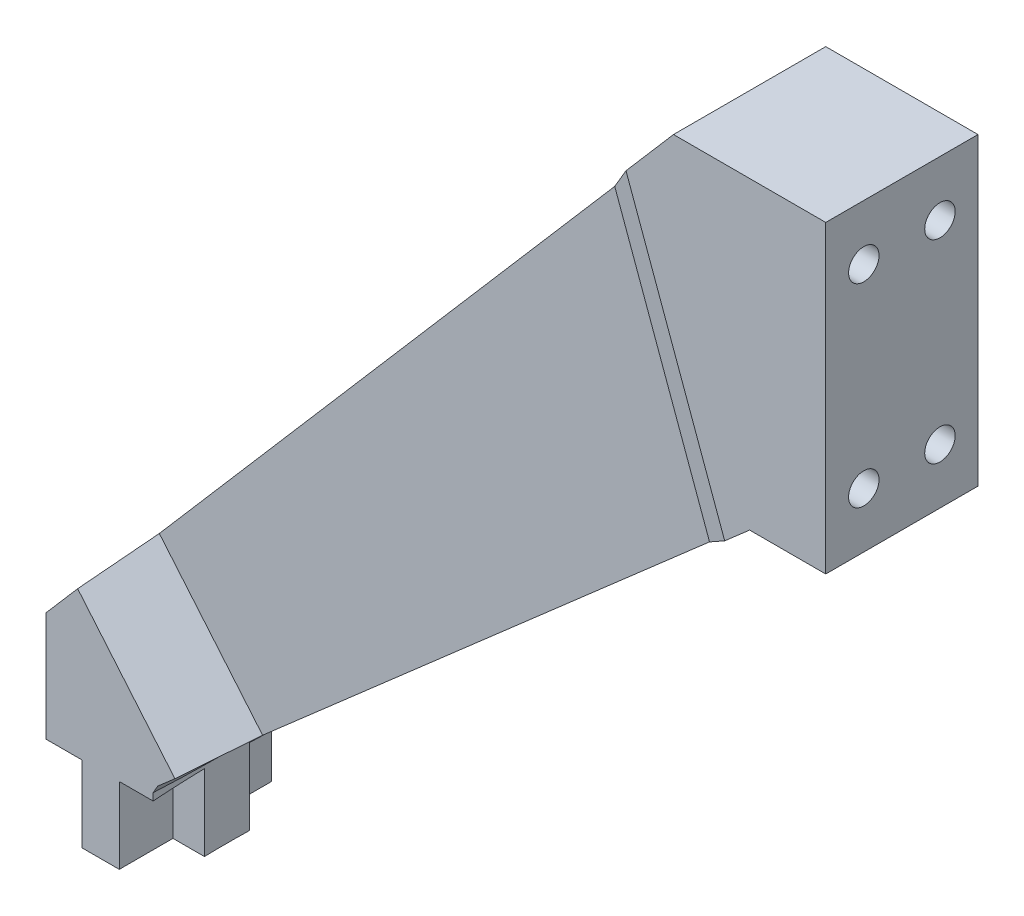
from build123d import *

# Parameters (mm, degrees)
BOSS_EXTRUDE1_DEPTH        = 10
SKETCH2_W                  = 5.05
SKETCH2_H                  = 7.05
CUT_EXTRUDE6_DEPTH         = 10
CUT_EXTRUDE7_DEPTH         = 5
CHAMFER2_SIZE              = 5.196152423
CHAMFER2_SIZE_2            = 9
CHAMFER2_OF_MIRROR4_SIZE   = 5.196152423
CHAMFER2_OF_MIRROR4_SIZE_2 = 9
SKETCH5_R                  = 2
CUT_EXTRUDE5_DEPTH         = 6
CUT_EXTRUDE8_START         = -120
CUT_EXTRUDE8_DEPTH         = 24.374622763
SKETCH8_R                  = 144.95
CUT_EXTRUDE9_DEPTH         = 12
BOSS_EXTRUDE2_DEPTH        = 20


# Read off the part's stored shape, not the designer's step: Cut-Extrude8
with BuildPart() as part:
    # Sketch1 → Boss-Extrude1 (new, symmetric)
    with BuildSketch(Plane.XY):
        Polygon((0, 120), (0, 80), (-10, 80), (-87.75, 12), (-87.75, 0), (-102.75, 0), (-102.75, 24), (-20, 120), align=None)
    extrude(amount=BOSS_EXTRUDE1_DEPTH, both=True)

    # Sketch2 → Cut-Extrude6 (cut)
    with BuildSketch(Plane.XZ):
        with Locations((-100.225, 6.475)):
            Rectangle(SKETCH2_W, SKETCH2_H)
        with Locations((-90.275, 6.475)):
            Rectangle(SKETCH2_W, SKETCH2_H)
        with Locations((-90.275, -6.475)):
            Rectangle(SKETCH2_W, SKETCH2_H)
        with Locations((-100.225, -6.475)):
            Rectangle(SKETCH2_W, SKETCH2_H)
    extrude(amount=-CUT_EXTRUDE6_DEPTH, mode=Mode.SUBTRACT)

    # Sketch6 → Cut-Extrude7 (cut)
    with BuildSketch(Plane.XY.offset(10)):
        Polygon((-98.494242528, 28.937192959), (-85.75, 13.749196141), (-13, 77.376205788), (-25.986145629, 113.055347669), align=None)
    cut_extrude7 = extrude(amount=-CUT_EXTRUDE7_DEPTH, mode=Mode.SUBTRACT)

    # Chamfer2
    # the kernel refuses this chamfer: 9, 5.196152423 mm, written as the material it adds along each edge
    with BuildSketch(Plane(origin=(-5.036481035, 55.496617251, 5), x_dir=(0.05440243528858507, 0.019800867116638043, 0.9983227437537925), z_dir=(-0.342020143325666, 0.9396926207859094, 0))) as chamfer2_piece_1_section:
        Polygon((CHAMFER2_SIZE * 0.998322743697, -CHAMFER2_SIZE * 0.0578938623994), (-CHAMFER2_SIZE_2 * 0.0578938624027, -CHAMFER2_SIZE_2 * 0.998322743754), (0, 0), align=None)
    chamfer2_piece_1 = extrude(amount=84.536493315, mode=Mode.PRIVATE)
    chamfer2_piece_1 = split(chamfer2_piece_1, bisect_by=Plane(origin=(-21.83844233, 92.842389445, 10), z_dir=(0, 0, -1)), keep=Keep.TOP, mode=Mode.PRIVATE)
    chamfer2_piece_1 = split(chamfer2_piece_1, bisect_by=Plane(origin=(-34.214088998, 103.509939047, 6.650101228), z_dir=(0.7574435982041207, -0.6529006015769894, 0)), keep=Keep.TOP, mode=Mode.PRIVATE)
    chamfer2_piece_1 = split(chamfer2_piece_1, bisect_by=Plane(origin=(-10.343648825, 79.699445401, 6.650101228), z_dir=(-0.6583332390976693, 0.7527266079388791, 0)), keep=Keep.TOP, mode=Mode.PRIVATE)
    add(chamfer2_piece_1)
    with BuildSketch(Plane(origin=(-113.460762542, 46.773596955, 5), x_dir=(-0.04434927158426045, -0.03721345742933334, 0.9983227437537927), z_dir=(0.642787609686533, -0.7660444431189835, 0))) as chamfer2_piece_2_section:
        Polygon((CHAMFER2_SIZE * 0.998322743697, -CHAMFER2_SIZE * 0.0578938623994), (-CHAMFER2_SIZE_2 * 0.0578938624027, -CHAMFER2_SIZE_2 * 0.998322743754), (0, 0), align=None)
    chamfer2_piece_2 = extrude(amount=66.394065339, mode=Mode.PRIVATE)
    chamfer2_piece_2 = split(chamfer2_piece_2, bisect_by=Plane(origin=(-97.520772346, 30.066536009, 6.631431033), z_dir=(0.7574435982041207, -0.6529006015769894, 0)), keep=Keep.TOP, mode=Mode.PRIVATE)
    chamfer2_piece_2 = split(chamfer2_piece_2, bisect_by=Plane(origin=(-83.277010041, 15.912068389, 6.631431033), z_dir=(-0.6583332390976693, 0.7527266079388791, 0)), keep=Keep.TOP, mode=Mode.PRIVATE)
    chamfer2_piece_2 = split(chamfer2_piece_2, bisect_by=Plane(origin=(-89.945880011, 23.537136627, 10), z_dir=(0, 0, -1)), keep=Keep.TOP, mode=Mode.PRIVATE)
    add(chamfer2_piece_2)

    # Mirror4: Cut-Extrude7 across plane
    add(cut_extrude7.mirror(Plane.XY), mode=Mode.SUBTRACT)

    # Chamfer2 of Mirror4
    # the kernel refuses this chamfer: 9, 5.196152423 mm, written as the material it adds along each edge
    with BuildSketch(Plane(origin=(-5.036481035, 55.496617251, -5), x_dir=(0.05440243528858507, 0.019800867116638043, -0.9983227437537925), z_dir=(-0.342020143325666, 0.9396926207859094, 0))) as chamfer2_of_mirror4_piece_1_section:
        Polygon((CHAMFER2_OF_MIRROR4_SIZE * 0.998322743697, CHAMFER2_OF_MIRROR4_SIZE * 0.0578938623994), (-CHAMFER2_OF_MIRROR4_SIZE_2 * 0.0578938624027, CHAMFER2_OF_MIRROR4_SIZE_2 * 0.998322743754), (0, 0), align=None)
    chamfer2_of_mirror4_piece_1 = extrude(amount=84.536493315, mode=Mode.PRIVATE)
    chamfer2_of_mirror4_piece_1 = split(chamfer2_of_mirror4_piece_1, bisect_by=Plane(origin=(-34.214088998, 103.509939047, -6.650101228), z_dir=(0.7574435982040639, -0.6529006015770552, 0)), keep=Keep.TOP, mode=Mode.PRIVATE)
    chamfer2_of_mirror4_piece_1 = split(chamfer2_of_mirror4_piece_1, bisect_by=Plane(origin=(-10.343648825, 79.699445401, -6.650101228), z_dir=(-0.6583332390977968, 0.7527266079387677, 0)), keep=Keep.TOP, mode=Mode.PRIVATE)
    chamfer2_of_mirror4_piece_1 = split(chamfer2_of_mirror4_piece_1, bisect_by=Plane(origin=(-21.83844233, 92.842389445, -10), z_dir=(0, 0, 1)), keep=Keep.TOP, mode=Mode.PRIVATE)
    add(chamfer2_of_mirror4_piece_1)
    with BuildSketch(Plane(origin=(-113.460762542, 46.773596955, -5), x_dir=(0.7659013618145366, 0.6426675502167433, 0.019326765612700778), z_dir=(0.642787609686533, -0.7660444431189835, 0))) as chamfer2_of_mirror4_piece_2_section:
        Polygon((CHAMFER2_OF_MIRROR4_SIZE_2 * 0.999813220622, -CHAMFER2_OF_MIRROR4_SIZE_2 * 0.0193267656127), (-CHAMFER2_OF_MIRROR4_SIZE * 0.0193267656116, -CHAMFER2_OF_MIRROR4_SIZE * 0.999813220566), (0, 0), align=None)
    chamfer2_of_mirror4_piece_2 = extrude(amount=66.394065339, mode=Mode.PRIVATE)
    chamfer2_of_mirror4_piece_2 = split(chamfer2_of_mirror4_piece_2, bisect_by=Plane(origin=(-97.520772346, 30.066536009, -6.631431033), z_dir=(0.7574435982040639, -0.6529006015770552, 0)), keep=Keep.TOP, mode=Mode.PRIVATE)
    chamfer2_of_mirror4_piece_2 = split(chamfer2_of_mirror4_piece_2, bisect_by=Plane(origin=(-83.277010041, 15.912068389, -6.631431033), z_dir=(-0.6583332390977968, 0.7527266079387677, 0)), keep=Keep.TOP, mode=Mode.PRIVATE)
    chamfer2_of_mirror4_piece_2 = split(chamfer2_of_mirror4_piece_2, bisect_by=Plane(origin=(-89.945880011, 23.537136627, -10), z_dir=(0, 0, 1)), keep=Keep.TOP, mode=Mode.PRIVATE)
    add(chamfer2_of_mirror4_piece_2)

    # Sketch5 → Cut-Extrude5 (cut)
    with BuildSketch(Plane(origin=(0, 0, 0), x_dir=(0, 0, -1), z_dir=(1, 0, 0))):
        with Locations((-5, 112.75)):
            Circle(SKETCH5_R)
        with Locations((-5, 87.25)):
            Circle(SKETCH5_R)
        with Locations(Location((5, 87.25, 0), (0, 0, 180))):
            Circle(SKETCH5_R)
        with Locations(Location((5, 112.75, 0), (0, 0, 180))):
            Circle(SKETCH5_R)
    extrude(amount=-CUT_EXTRUDE5_DEPTH, mode=Mode.SUBTRACT)

    # Cut-Extrude8 outline → Cut-Extrude8 (cut)
    with BuildSketch(Plane(origin=(0, 120, 0), x_dir=(1, 0, 0), z_dir=(0, 1, 0)).offset(CUT_EXTRUDE8_START)):
        with BuildLine():
            Line((-102.75, 7.56e-07), (-102.75, -10))
            Line((-102.75, -10), (-102.427082983, -10))
            ThreePointArc((-102.427082983, -10), (-102.669249724, -5.002605828), (-102.75, 7.56e-07))
        make_face()
        with BuildLine():
            Line((-102.427082983, 10), (-102.75, 10))
            Line((-102.75, 10), (-102.75, 7.56e-07))
            ThreePointArc((-102.75, 7.56e-07), (-102.669249699, 5.002606583), (-102.427082983, 10))
        make_face()
    extrude(amount=CUT_EXTRUDE8_DEPTH, mode=Mode.SUBTRACT)

    # Sketch8 → Cut-Extrude9 (cut)
    with BuildSketch(Plane.XZ):
        with Locations((56.25, 0)):
            Circle(SKETCH8_R)
    extrude(amount=-CUT_EXTRUDE9_DEPTH, mode=Mode.SUBTRACT)

    # Sketch10 → Boss-Extrude2 (add)
    with BuildSketch(Plane(origin=(0, 0, -10), x_dir=(-1, 0, 0), z_dir=(0, 0, -1))):
        Polygon((87.75, 12), (88.771540348, 10.230640215), (90.560927794, 10.230640215), (90.560927794, 12), align=None)
    extrude(amount=-BOSS_EXTRUDE2_DEPTH)


solid = part.part
